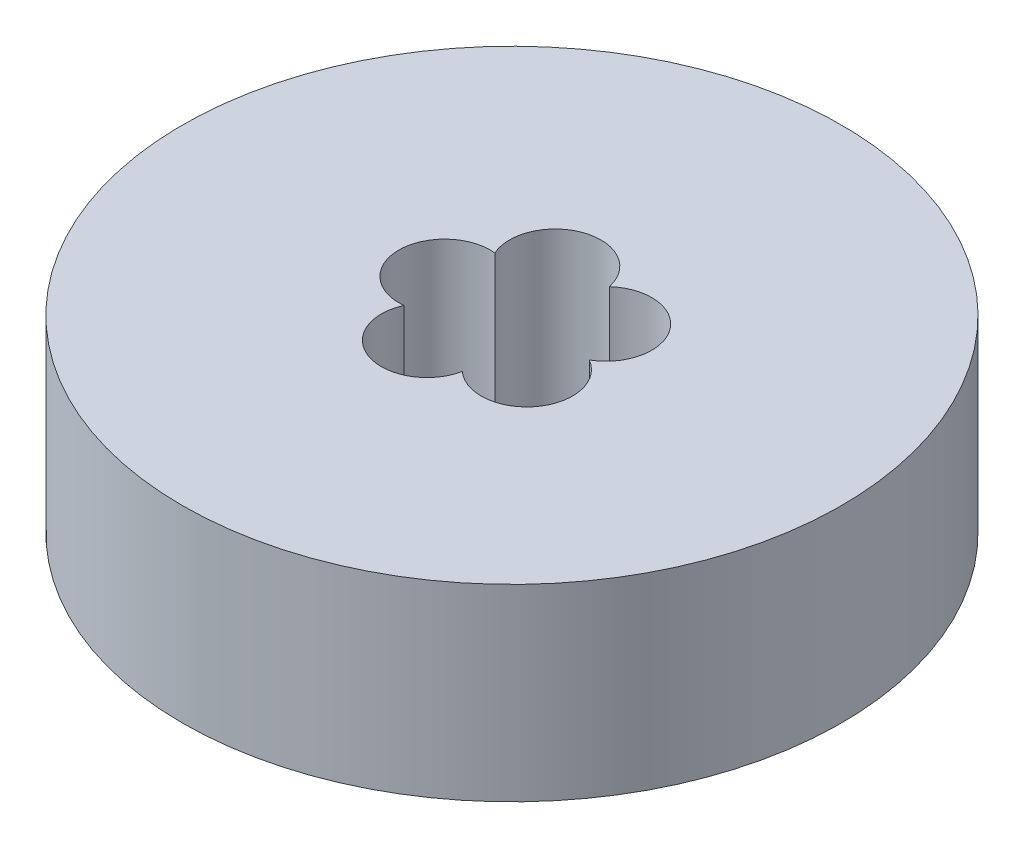
from build123d import *

# Parameters (mm, degrees)
SKETCH1_R           = 35
BOSS_EXTRUDE1_DEPTH = 20
SKETCH2_R           = 7.5
CUT_EXTRUDE1_DEPTH  = 54.38539126
SKETCH3_R           = 4.855176947
CUT_EXTRUDE2_DEPTH  = 17.075258824
CIRPATTERN1_COUNT   = 5


with BuildPart() as part:
    # Sketch1 → Boss-Extrude1 (new body)
    with BuildSketch(Plane(origin=(0, 0, 0), x_dir=(1, 0, 0), z_dir=(0, 1, 0))):
        Circle(SKETCH1_R)
    extrude(amount=BOSS_EXTRUDE1_DEPTH)

    # Sketch2 → Cut-Extrude1 (cut, through all)
    with BuildSketch(Plane(origin=(0, 0, 0), x_dir=(1, 0, 0), z_dir=(0, 1, 0))):
        Circle(SKETCH2_R)
    extrude(amount=CUT_EXTRUDE1_DEPTH, mode=Mode.SUBTRACT)

    # Sketch3 → Cut-Extrude2 (cut)
    with BuildSketch(Plane(origin=(0, 20, 0), x_dir=(1, 0, 0), z_dir=(0, 1, 0))):
        with Locations((-7.156774824, 0)):
            Circle(SKETCH3_R)
    cut_extrude2 = extrude(amount=-CUT_EXTRUDE2_DEPTH, mode=Mode.SUBTRACT)

    # CirPattern1: Cut-Extrude2 ×5 about axis
    cirpattern1_axis = Axis((0, 0, 0), (0, 1, 0))
    for i in range(1, CIRPATTERN1_COUNT):
        add(cut_extrude2.rotate(cirpattern1_axis, i * 360 / CIRPATTERN1_COUNT), mode=Mode.SUBTRACT)


solid = part.part
